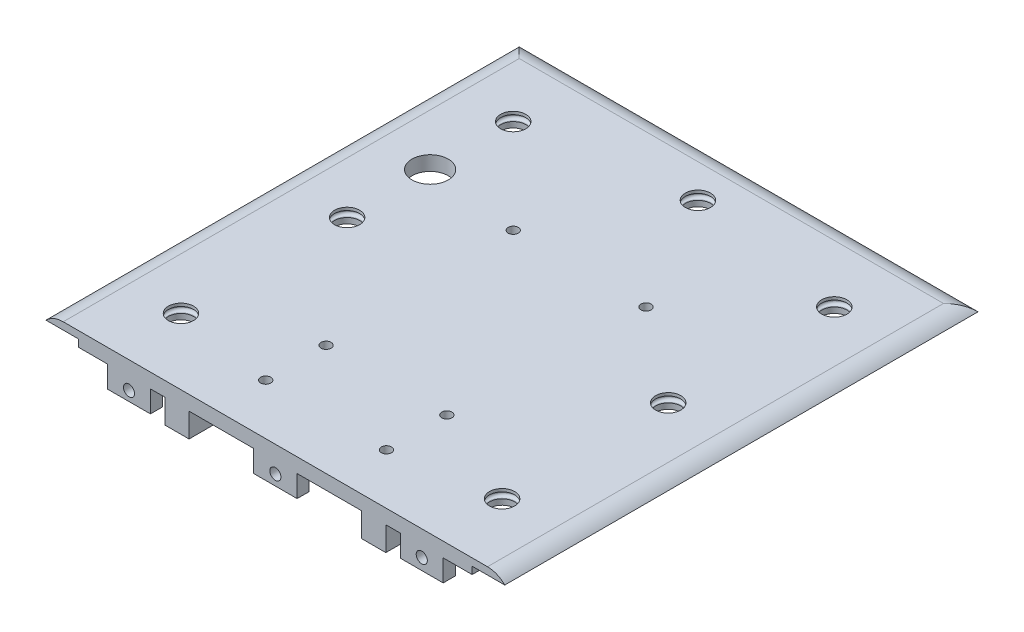
from build123d import *

# Parameters (mm, degrees)
SKETCH_1_W          = 190
SKETCH_1_H          = 196
EXTRUDE_1_DEPTH     = 3
FILLET_1_R          = 10
SKETCH_2_W          = 163
SKETCH_2_H          = 187
EXTRUDE_2_DEPTH     = 3
SKETCH_3_W          = 10
SKETCH_3_H          = 108.85
EXTRUDE_3_DEPTH     = 10
SKETCH_4_W          = 17.75
SKETCH_4_H          = 5
SKETCH_4_W_2        = 18
EXTRUDE_4_DEPTH     = 9
SKETCH_5_R          = 2.3
CUT_EXTRUDE_1_DEPTH = 9
SKETCH_6_R          = 2.3
CUT_EXTRUDE_2_DEPTH = 230
FILLET_2_R          = 2
SKETCH_8_R          = 5.2
CUT_EXTRUDE_3_DEPTH = 10
CUT_EXTRUDE_START   = -1.2
SKETCH_9_R          = 6.7
CUT_EXTRUDE_4_DEPTH = 2.5
FILLET_3_R          = 1.2
SKETCH_12_R         = 7.5
CUT_EXTRUDE_5_DEPTH = 10
SKETCH_13_R         = 2.1
CUT_EXTRUDE_6_DEPTH = 5


with BuildPart() as part:
    # Эскиз1 → Бобышка-Вытянуть1 (new body)
    with BuildSketch(Plane(origin=(0, 0, 0), x_dir=(1, 0, 0), z_dir=(0, 1, 0))):
        with Locations((95, 98)):
            Rectangle(SKETCH_1_W, SKETCH_1_H)
    extrude(amount=EXTRUDE_1_DEPTH)

    # Скругление1
    # the kernel refuses this fillet: 10 mm, written as the material it takes off along each edge
    with BuildSketch(Plane(origin=(207.853571071, 3, -196), x_dir=(0, -1, 0), z_dir=(-1, 0, 0))) as fillet_1_piece_1:
        with BuildLine():
            CenterArc((10, 7.141428429), FILLET_1_R, 180, 45.572995999)
            Line((0, 7.141428429), (-0.2, 7.141428429))
            Line((-0.2, 7.141428429), (-0.2, 0))
            Line((-0.2, 0), (0, -0.2))
            ThreePointArc((0, -0.2), (1.5, -0.2), (2.86, -0.142828569))
            Line((2.86, -0.142828569), (3, 0))
        make_face()
    extrude(amount=225.707142143, mode=Mode.SUBTRACT)
    with BuildSketch(Plane(origin=(190, 3, 17.853571071), x_dir=(0, -1, 0), z_dir=(0, 0, -1)), Plane(origin=(0, 3, -213.853571071), x_dir=(0, -1, 0), z_dir=(0, 0, 1))) as fillet_1_piece_2:
        with BuildLine():
            CenterArc((10, 7.141428429), FILLET_1_R, 180, 45.572995999)
            Line((0, 7.141428429), (-0.2, 7.141428429))
            Line((-0.2, 7.141428429), (-0.2, 0))
            Line((-0.2, 0), (0, -0.2))
            ThreePointArc((0, -0.2), (1.5, -0.2), (2.86, -0.142828569))
            Line((2.86, -0.142828569), (3, 0))
        make_face()
    extrude(amount=231.707142143, mode=Mode.SUBTRACT)

    # Эскиз2 → Бобышка-Вытянуть2 (add)
    with BuildSketch(Plane.XZ):
        with Locations((95, -93.5)):
            Rectangle(SKETCH_2_W, SKETCH_2_H)
    extrude(amount=EXTRUDE_2_DEPTH)

    # Эскиз3 → Бобышка-Вытянуть3 (add)
    with BuildSketch(Plane.XZ.offset(3)):
        with Locations((54.25, -54.425)):
            Rectangle(SKETCH_3_W, SKETCH_3_H)
        with Locations((135.75, -54.425)):
            Rectangle(SKETCH_3_W, SKETCH_3_H)
    extrude(amount=EXTRUDE_3_DEPTH)

    # Эскиз4 → Бобышка-Вытянуть4 (add)
    with BuildSketch(Plane.XZ.offset(3)):
        with Locations((34.375, -2.5)):
            Rectangle(SKETCH_4_W, SKETCH_4_H)
        with Locations((95, -2.5)):
            Rectangle(SKETCH_4_W_2, SKETCH_4_H)
        with Locations((155.625, -2.5)):
            Rectangle(SKETCH_4_W, SKETCH_4_H)
    extrude(amount=EXTRUDE_4_DEPTH)

    # Эскиз5 → Вырез-Вытянуть1 (cut)
    with BuildSketch(Plane.XY):
        with Locations((95, -7.645927853)):
            Circle(SKETCH_5_R)
        with Locations((155.625, -7.291855705)):
            Circle(SKETCH_5_R)
        with Locations((34.375, -8)):
            Circle(SKETCH_5_R)
    extrude(amount=-CUT_EXTRUDE_1_DEPTH, mode=Mode.SUBTRACT)

    # Эскиз6 → Вырез-Вытянуть2 (cut)
    with BuildSketch(Plane.ZY.offset(-49.25)):
        with Locations((-93.85, -9)):
            Circle(SKETCH_6_R)
        with Locations((-53.85, -9)):
            Circle(SKETCH_6_R)
    extrude(amount=-CUT_EXTRUDE_2_DEPTH, mode=Mode.SUBTRACT)

    # Скругление2
    fillet_2_edges = [part.edges().sort_by_distance(p)[0] for p in [
        (95, -3, -187),
    ]]
    fillet(fillet_2_edges, radius=FILLET_2_R)

    # Эскиз8 → Вырез-Вытянуть3 (cut)
    with BuildSketch(Plane.XZ.offset(3)):
        with Locations(Location((28.5, -27.4, 0), (0, 0, 270))):
            Circle(SKETCH_8_R)
        with Locations(Location((28.5, -96.2, 0), (0, 0, 270))):
            Circle(SKETCH_8_R)
        with Locations(Location((28.5, -165, 0), (0, 0, 270))):
            Circle(SKETCH_8_R)
        with Locations(Location((95, -175, 0), (0, 0, 270))):
            Circle(SKETCH_8_R)
        with Locations(Location((161.5, -165, 0), (0, 0, 270))):
            Circle(SKETCH_8_R)
        with Locations(Location((161.5, -96.2, 0), (0, 0, 270))):
            Circle(SKETCH_8_R)
        with Locations(Location((161.5, -27.4, 0), (0, 0, 270))):
            Circle(SKETCH_8_R)
    extrude(amount=-CUT_EXTRUDE_3_DEPTH, mode=Mode.SUBTRACT)

    # Эскиз9 → Вырез-Вытянуть4 (cut)
    with BuildSketch(Plane(origin=(0, 3, 0), x_dir=(1, 0, 0), z_dir=(0, 1, 0)).offset(CUT_EXTRUDE_START)):
        with Locations(Location((28.5, 27.4, 0), (0, 0, 270))):
            Circle(SKETCH_9_R)
        with Locations(Location((28.5, 96.2, 0), (0, 0, 270))):
            Circle(SKETCH_9_R)
        with Locations(Location((28.5, 165, 0), (0, 0, 270))):
            Circle(SKETCH_9_R)
        with Locations(Location((95, 175, 0), (0, 0, 270))):
            Circle(SKETCH_9_R)
        with Locations(Location((161.5, 165, 0), (0, 0, 270))):
            Circle(SKETCH_9_R)
        with Locations(Location((161.5, 96.2, 0), (0, 0, 270))):
            Circle(SKETCH_9_R)
        with Locations(Location((161.5, 27.4, 0), (0, 0, 270))):
            Circle(SKETCH_9_R)
    extrude(amount=-CUT_EXTRUDE_4_DEPTH, mode=Mode.SUBTRACT)

    # Скругление3
    fillet_3_edges = [part.edges().sort_by_distance(p)[0] for p in [
        (28.5, 1.8, -102.9),
        (28.5, -0.7, -102.9),
        (28.5, 1.8, -171.7),
        (28.5, -0.7, -171.7),
        (95, 1.8, -181.7),
        (95, -0.7, -181.7),
        (161.5, 1.8, -171.7),
        (161.5, -0.7, -171.7),
        (161.5, 1.8, -102.9),
        (161.5, -0.7, -102.9),
        (161.5, 1.8, -34.1),
        (161.5, -0.7, -34.1),
        (28.5, 1.8, -34.1),
        (28.5, -0.7, -34.1),
    ]]
    fillet(fillet_3_edges, radius=FILLET_3_R)

    # Эскиз12 → Вырез-Вытянуть5 (cut)
    with BuildSketch(Plane.XZ.offset(3)):
        with Locations(Location((28.5, -130.6, 0), (0, 0, 270))):
            Circle(SKETCH_12_R)
    extrude(amount=-CUT_EXTRUDE_5_DEPTH, mode=Mode.SUBTRACT)

    # Эскиз13 → Вырез-Вытянуть6 (cut)
    with BuildSketch(Plane(origin=(0, 3, 0), x_dir=(1, 0, 0), z_dir=(0, 1, 0))):
        with Locations(Location((67.5, 126, 0), (0, 0, 270))):
            Circle(SKETCH_13_R)
        with Locations(Location((122.5, 126, 0), (0, 0, 270))):
            Circle(SKETCH_13_R)
        with Locations(Location((70, 46, 0), (0, 0, 270))):
            Circle(SKETCH_13_R)
        with Locations(Location((70, 21, 0), (0, 0, 270))):
            Circle(SKETCH_13_R)
        with Locations(Location((120, 21, 0), (0, 0, 270))):
            Circle(SKETCH_13_R)
        with Locations(Location((120, 46, 0), (0, 0, 270))):
            Circle(SKETCH_13_R)
    extrude(amount=-CUT_EXTRUDE_6_DEPTH, mode=Mode.SUBTRACT)


solid = part.part
